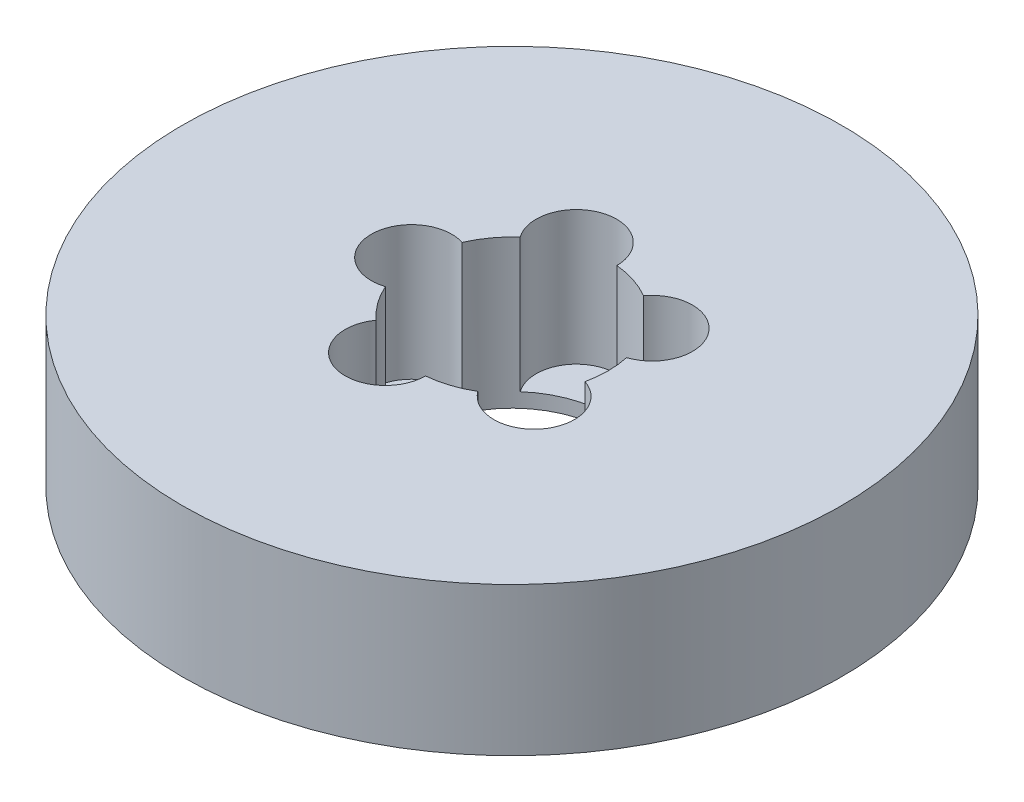
from build123d import *

# Parameters (mm, degrees)
SKETCH1_R           = 60
BOSS_EXTRUDE1_DEPTH = 27
SKETCH2_R           = 17.5
CUT_EXTRUDE1_DEPTH  = 90.044932478
SKETCH3_R           = 7.330143431
CUT_EXTRUDE2_DEPTH  = 24.380136428
CIRPATTERN1_COUNT   = 5


with BuildPart() as part:
    # Sketch1 → Boss-Extrude1 (new body)
    with BuildSketch(Plane(origin=(0, 0, 0), x_dir=(1, 0, 0), z_dir=(0, 1, 0))):
        Circle(SKETCH1_R)
    extrude(amount=BOSS_EXTRUDE1_DEPTH)

    # Sketch2 → Cut-Extrude1 (cut, through all)
    with BuildSketch(Plane(origin=(0, 0, 0), x_dir=(1, 0, 0), z_dir=(0, 1, 0))):
        Circle(SKETCH2_R)
    extrude(amount=CUT_EXTRUDE1_DEPTH, mode=Mode.SUBTRACT)

    # Sketch3 → Cut-Extrude2 (cut)
    with BuildSketch(Plane(origin=(0, 27, 0), x_dir=(1, 0, 0), z_dir=(0, 1, 0))):
        with Locations((-18.275834868, 0)):
            Circle(SKETCH3_R)
    cut_extrude2 = extrude(amount=-CUT_EXTRUDE2_DEPTH, mode=Mode.SUBTRACT)

    # CirPattern1: Cut-Extrude2 ×5 about axis
    cirpattern1_axis = Axis((0, 0, 0), (0, 1, 0))
    for i in range(1, CIRPATTERN1_COUNT):
        add(cut_extrude2.rotate(cirpattern1_axis, i * 360 / CIRPATTERN1_COUNT), mode=Mode.SUBTRACT)


solid = part.part
